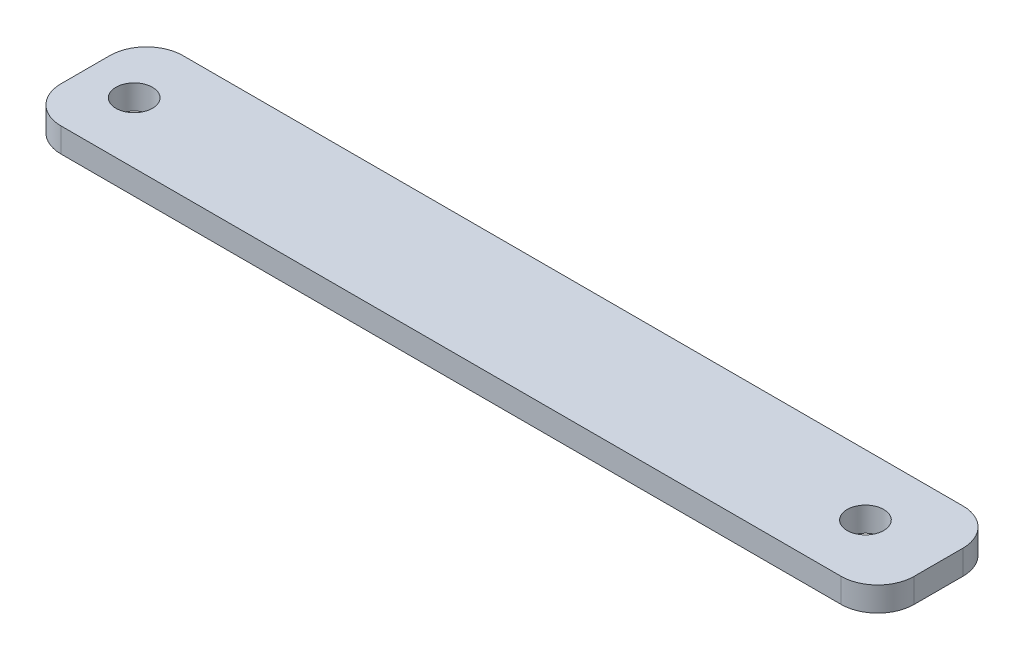
from build123d import *

# Parameters (mm, degrees)
SKETCH1_W             = 70
SKETCH1_H             = 10
BOSS_EXTRUDE1_DEPTH   = 2
FILLET1_R             = 3
F_3_0MM_DOWEL_HOLE1_D = 3


with BuildPart() as part:
    # Sketch1 → Boss-Extrude1 (new body)
    with BuildSketch(Plane(origin=(0, 0, 0), x_dir=(1, 0, 0), z_dir=(0, 1, 0))):
        Rectangle(SKETCH1_W, SKETCH1_H)
    extrude(amount=BOSS_EXTRUDE1_DEPTH)

    # Fillet1
    fillet1_edges = [part.edges().sort_by_distance(p)[0] for p in [
        (35, 1, 5),
        (35, 1, -5),
        (-35, 1, 5),
        (-35, 1, -5),
    ]]
    fillet(fillet1_edges, radius=FILLET1_R)

    # Ø3.0mm Dowel Hole1 (through all)
    with Locations(Plane(origin=(0, 0, 0), x_dir=(-1, 0, 0), z_dir=(0, -1, 0))):
        with Locations((-29, 0), (31, 0)):
            Hole(F_3_0MM_DOWEL_HOLE1_D / 2)


solid = part.part
